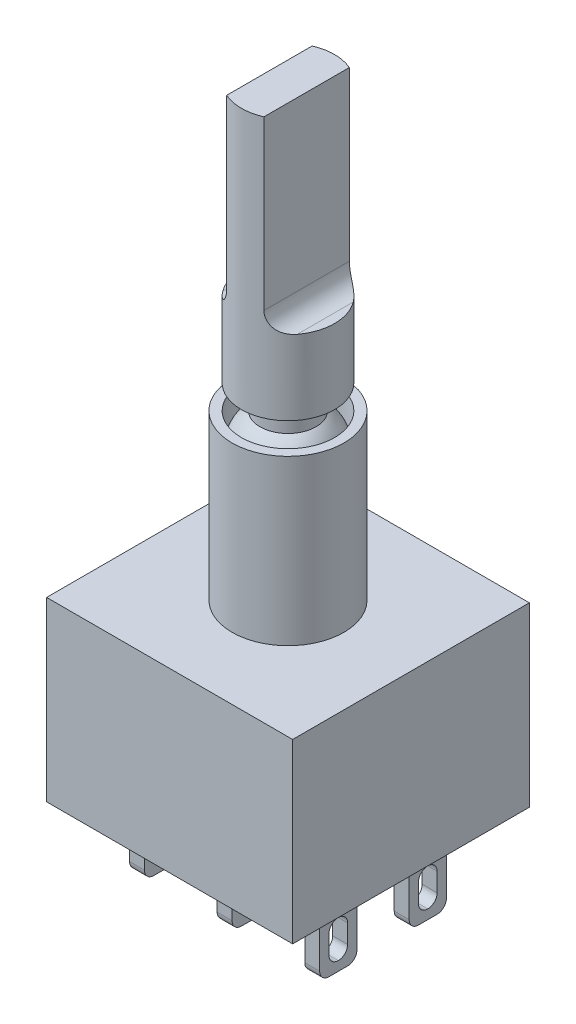
from build123d import *
from build123d.topology import SkipClean

# Parameters (mm, degrees)
SKETCH1_W           = 13.2
SKETCH1_H           = 12.7
BOSS_EXTRUDE1_DEPTH = 9.5
SKETCH2_R           = 3
BOSS_EXTRUDE2_DEPTH = 8.8
SKETCH4_R           = 2.5
CUT_EXTRUDE1_DEPTH  = 2
SKETCH5_R           = 1.5
BOSS_EXTRUDE3_DEPTH = 5
REVOLVE2_ANGLE      = 180
FILLET1_R           = 1
SKETCH6_W           = 0.8
SKETCH6_H           = 2
BOSS_EXTRUDE4_DEPTH = 4
SKETCH7_W           = 1
SKETCH7_H           = 2
CUT_EXTRUDE2_DEPTH  = 26.117773
FILLET2_R           = 0.5
BOSS_EXTRUDE5_START = 5.3
SKETCH8_R           = 2.5
BOSS_EXTRUDE5_DEPTH = 4
BOSS_EXTRUDE6_START = 10
BOSS_EXTRUDE6_DEPTH = 10
FILLET3_R           = 1


# Some blends are built 0.0001 mm under size
with BuildPart() as part:
    # Sketch1 → Boss-Extrude1 (new body)
    with BuildSketch(Plane(origin=(0, 0, 0), x_dir=(1, 0, 0), z_dir=(0, 1, 0))):
        Rectangle(SKETCH1_W, SKETCH1_H)
    extrude(amount=BOSS_EXTRUDE1_DEPTH)

    # Sketch2 → Boss-Extrude2 (add)
    with BuildSketch(Plane(origin=(0, 9.5, 0), x_dir=(1, 0, 0), z_dir=(0, 1, 0))):
        with Locations(Location((0, 0, 0), (0, 0, 270))):
            Circle(SKETCH2_R)
    extrude(amount=BOSS_EXTRUDE2_DEPTH)

    # Sketch4 → Cut-Extrude1 (cut)
    with BuildSketch(Plane(origin=(0, 18.3, 0), x_dir=(1, 0, 0), z_dir=(0, 1, 0))):
        with Locations(Location((0, 0, 0), (0, 0, 270))):
            Circle(SKETCH4_R)
    extrude(amount=-CUT_EXTRUDE1_DEPTH, mode=Mode.SUBTRACT)

    # Sketch5 → Boss-Extrude3 (add)
    with BuildSketch(Plane(origin=(0, 16.3, 0), x_dir=(1, 0, 0), z_dir=(0, 1, 0))):
        with Locations(Location((0, 0, 0), (0, 0, 270))):
            Circle(SKETCH5_R)
    extrude(amount=BOSS_EXTRUDE3_DEPTH)

    # Sketch3 → Revolve2 (revolve)
    with BuildSketch(Plane(origin=(0, 16.3, 0), x_dir=(1, 0, 0), z_dir=(0, 1, 0))):
        with BuildLine():
            Line((0, -2.5), (0, 2.5))
            ThreePointArc((0, 2.5), (-2.5, 0), (0, -2.5))
        make_face()
    revolve(axis=Axis((0, 16.3, 3), (0, 0, -1)), revolution_arc=REVOLVE2_ANGLE)

    # Fillet1
    fillet1_edges = [part.edges().sort_by_distance(p)[0] for p in [
        (0, 21.3, -1.5),
    ]]
    fillet(fillet1_edges, radius=FILLET1_R)

    # Sketch6 → Boss-Extrude4 (add)
    with BuildSketch(Plane.XZ):
        with Locations((-4.7, 2.4)):
            Rectangle(SKETCH6_W, SKETCH6_H)
        with Locations((-4.7, -2.4)):
            Rectangle(SKETCH6_W, SKETCH6_H)
        with Locations((0, -2.4)):
            Rectangle(SKETCH6_W, SKETCH6_H)
        with Locations((0, 2.4)):
            Rectangle(SKETCH6_W, SKETCH6_H)
        with Locations((4.7, 2.4)):
            Rectangle(SKETCH6_W, SKETCH6_H)
        with Locations((4.7, -2.4)):
            Rectangle(SKETCH6_W, SKETCH6_H)
    extrude(amount=BOSS_EXTRUDE4_DEPTH)

    # Sketch7 → Cut-Extrude2 (cut, through all)
    with BuildSketch(Plane.ZY.offset(5.1)):
        with Locations((-2.4, -2.5)):
            Rectangle(SKETCH7_W, SKETCH7_H)
        with Locations((2.4, -2.5)):
            Rectangle(SKETCH7_W, SKETCH7_H)
    extrude(amount=-CUT_EXTRUDE2_DEPTH, mode=Mode.SUBTRACT)

    # Fillet2
    fillet2_edges = [part.edges().sort_by_distance(p)[0] for p in [
        (4.7, -3.5, 2.9),
        (4.7, -3.5, 1.9),
        (4.7, -3.5, -1.9),
        (4.7, -3.5, -2.9),
        (4.7, -1.5, -1.9),
        (4.7, -1.5, 2.9),
        (4.7, -1.5, 1.9),
        (4.7, -1.5, -2.9),
        (0, -1.5, 1.9),
        (0, -1.5, 2.9),
        (0, -3.5, 2.9),
        (0, -3.5, 1.9),
        (0, -3.5, -1.9),
        (0, -3.5, -2.9),
        (0, -1.5, -2.9),
        (0, -1.5, -1.9),
        (-4.7, -3.5, 2.9),
        (-4.7, -1.5, 2.9),
        (-4.7, -3.5, 1.9),
        (-4.7, -1.5, 1.9),
        (-4.7, -1.5, -1.9),
        (-4.7, -1.5, -2.9),
        (-4.7, -3.5, -1.9),
        (-4.7, -3.5, -2.9),
        (0, -4, -1.4),
        (0, -4, -3.4),
        (4.7, -4, -1.4),
        (4.7, -4, -3.4),
        (4.7, -4, 1.4),
        (4.7, -4, 3.4),
        (0, -4, 3.4),
        (0, -4, 1.4),
        (-4.7, -4, 3.4),
        (-4.7, -4, 1.4),
        (-4.7, -4, -1.4),
        (-4.7, -4, -3.4),
    ]]
    fillet(fillet2_edges, radius=FILLET2_R - 0.0001)  # a hair under: the kernel refuses the full size

    # Sketch8 → Boss-Extrude5 (add)
    with BuildSketch(Plane(origin=(0, 18.3, 0), x_dir=(1, 0, 0), z_dir=(0, 1, 0)).offset(BOSS_EXTRUDE5_START)):
        with Locations(Location((0, 0, 0), (0, 0, 270))):
            Circle(SKETCH8_R)
    extrude(amount=-BOSS_EXTRUDE5_DEPTH)

    # Sketch9 → Boss-Extrude6 (add)
    with SkipClean():  # the faces are left unmerged after this step: merging them gives an invalid solid
        with BuildSketch(Plane(origin=(0, 23.6, 0), x_dir=(1, 0, 0), z_dir=(0, 1, 0)).offset(BOSS_EXTRUDE6_START)):
            with BuildLine():
                Line((-1, -2.291288), (-1, 2.291288))
                ThreePointArc((-1, 2.291288), (0, 2.5), (1, 2.291288))
                Line((1, 2.291288), (1, -2.291288))
                ThreePointArc((1, -2.291288), (0, -2.5), (-1, -2.291288))
            make_face()
        extrude(amount=-BOSS_EXTRUDE6_DEPTH)

    # Fillet3
    # the kernel refuses this fillet: 1 mm, written as the material it adds along each edge
    with BuildSketch(Plane(origin=(1, 23.6, -4.791288), x_dir=(1, 0, 0), z_dir=(0, 0, 1))) as fillet3_piece_1_section:
        with BuildLine():
            CenterArc((FILLET3_R, FILLET3_R), FILLET3_R, 180, 90)
            Line((0, FILLET3_R), (0, 0))
            Line((0, 0), (FILLET3_R, 0))
        make_face()
    fillet3_piece_1 = extrude(amount=9.582576, mode=Mode.PRIVATE)
    fillet3_piece_1 = fillet3_piece_1 & Plane(origin=(0, 23.834238, 0), x_dir=(0, 0, 1), z_dir=(0, 1, 0)) * Cylinder(2.5, 24, mode=Mode.PRIVATE)
    add(fillet3_piece_1)
    with BuildSketch(Plane(origin=(-1, 23.6, 4.791288), x_dir=(-1, 0, 0), z_dir=(0, 0, -1))) as fillet3_piece_2_section:
        with BuildLine():
            CenterArc((FILLET3_R, FILLET3_R), FILLET3_R, 180, 90)
            Line((0, FILLET3_R), (0, 0))
            Line((0, 0), (FILLET3_R, 0))
        make_face()
    fillet3_piece_2 = extrude(amount=9.582576, mode=Mode.PRIVATE)
    fillet3_piece_2 = fillet3_piece_2 & Plane(origin=(0, 23.834238, 0), x_dir=(0, 0, 1), z_dir=(0, 1, 0)) * Cylinder(2.5, 24, mode=Mode.PRIVATE)
    add(fillet3_piece_2)


solid = part.part
